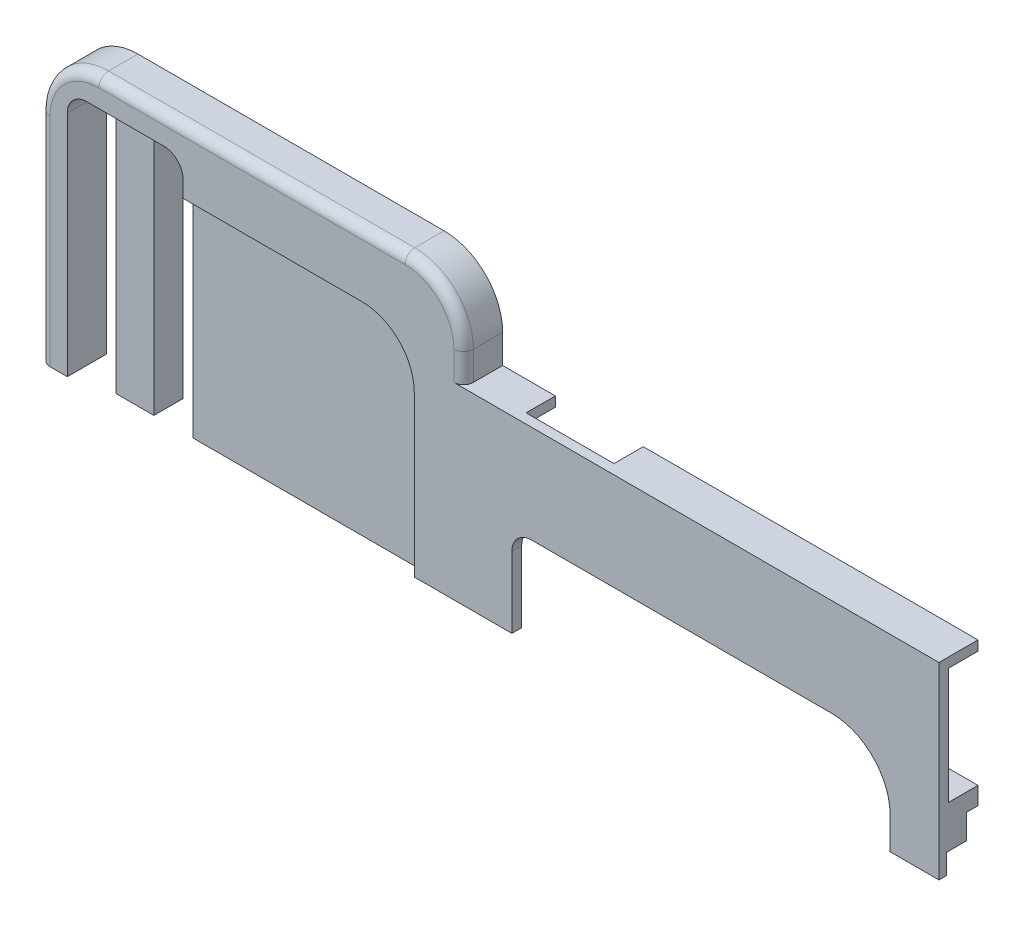
from build123d import *

# Parameters (mm, degrees)
EXTRUDE1_DEPTH           = 5.08
EXTRUDE2_DEPTH           = 1.27
EXTRUDE3_DEPTH           = 3.81
SKETCH1_5_W              = 4.91012523
SKETCH1_5_H              = 32.245498845
EXTRUDE4_DEPTH           = 3.81
FILLET2_R                = 1.27
FILLET3_R                = 1.27
SKETCH3_W                = 7.62
SKETCH3_H                = 71.709798158
CUT_EXTRUDE1_DEPTH       = 69.436
EXTRUDE_THIN4_DEPTH      = 61.816
EXTRUDE_THIN4_DEPTH_BACK = 5.08
SKETCH3_4_W              = 10.16
SKETCH3_4_H              = 48.987051728
SKETCH3_4_W_2            = 7.62
SKETCH3_4_H_2            = 46.447051728
CUT_EXTRUDE2_DEPTH       = 132.052100446
CUT_EXTRUDE2_DEPTH_BACK  = 132.052100446
SKETCH4_W                = 11.43
SKETCH4_H                = 7.62
CUT_EXTRUDE3_DEPTH       = 123.667785998
EXTRUDE7_START           = -6.35
EXTRUDE7_DEPTH           = 6.35
CUT_EXTRUDE4_DEPTH       = 6.35
CUT_EXTRUDE4_DRAFT       = -1
CUT_EXTRUDE5_DEPTH       = 123.351814538
CUT_EXTRUDE5_DEPTH_BACK  = 123.351814538


# Read off the part's stored shape, not the designer's step: Extrude7
with BuildPart() as part:
    # Sketch1 → Extrude1 (new, symmetric)
    with BuildSketch(Plane.XY):
        with BuildLine():
            Line((55.053954756, 23.223525864), (55.053954756, 28.234899079))
            ThreePointArc((55.053954756, 28.234899079), (52.822108428, 33.623052752), (47.433954756, 35.854899079))
            Line((47.433954756, 35.854899079), (7.62, 35.854899079))
            ThreePointArc((7.62, 35.854899079), (2.231846327, 33.623052752), (0, 28.234899079))
            Line((0, 28.234899079), (0, -28.234899079))
            ThreePointArc((0, -28.234899079), (2.231846327, -33.623052752), (7.62, -35.854899079))
            Line((7.62, -35.854899079), (47.433954756, -35.854899079))
            ThreePointArc((47.433954756, -35.854899079), (52.822108428, -33.623052752), (55.053954756, -28.234899079))
            Line((55.053954756, -28.234899079), (55.053954756, -23.223525864))
            Line((55.053954756, -23.223525864), (55.053954756, -19.324782682))
            Line((55.053954756, -19.324782682), (55.053954756, -16.240810389))
            Line((55.053954756, -16.240810389), (55.053954756, -5.571934871))
            Line((55.053954756, -5.571934871), (55.053954756, -2.359181621))
            Line((55.053954756, -2.359181621), (55.053954756, 2.359181621))
            Line((55.053954756, 2.359181621), (55.053954756, 5.571934871))
            Line((55.053954756, 5.571934871), (55.053954756, 16.240810389))
            Line((55.053954756, 16.240810389), (55.053954756, 19.324782682))
            Line((55.053954756, 19.324782682), (55.053954756, 23.223525864))
        make_face()
        with BuildLine():
            ThreePointArc((16.048576777, 32.245498845), (17.844628001, 31.501550069), (18.588576777, 29.705498845))
            Line((18.588576777, 29.705498845), (18.588576777, 27.618036038))
            Line((18.588576777, 27.618036038), (41.829183295, 27.618036038))
            ThreePointArc((41.829183295, 27.618036038), (46.643426698, 25.623911128), (48.637551607, 20.809667725))
            Line((48.637551607, 20.809667725), (48.637551607, -20.809667725))
            ThreePointArc((48.637551607, -20.809667725), (46.643426698, -25.623911128), (41.829183295, -27.618036038))
            Line((41.829183295, -27.618036038), (18.588576777, -27.618036038))
            Line((18.588576777, -27.618036038), (18.588576777, -29.705498845))
            ThreePointArc((18.588576777, -29.705498845), (17.844628001, -31.501550069), (16.048576777, -32.245498845))
            Line((16.048576777, -32.245498845), (13.508576777, -32.245498845))
            Line((13.508576777, -32.245498845), (8.598451547, -32.245498845))
            Line((8.598451547, -32.245498845), (6.058451547, -32.245498845))
            ThreePointArc((6.058451547, -32.245498845), (4.262400322, -31.501550069), (3.518451547, -29.705498845))
            Line((3.518451547, -29.705498845), (3.518451547, 29.705498845))
            ThreePointArc((3.518451547, 29.705498845), (4.262400322, 31.501550069), (6.058451547, 32.245498845))
            Line((6.058451547, 32.245498845), (8.598451547, 32.245498845))
            Line((8.598451547, 32.245498845), (13.508576777, 32.245498845))
            Line((13.508576777, 32.245498845), (16.048576777, 32.245498845))
        make_face(mode=Mode.SUBTRACT)
    extrude(amount=EXTRUDE1_DEPTH, both=True)

    # Sketch1<3> → Extrude2 (add, symmetric)
    with BuildSketch(Plane.XY):
        Polygon((110.911701022, 19.324782682), (55.053954756, 19.324782682), (55.053954756, 16.240810389), (107.354901489, 16.240810389), align=None)
        Polygon((114.44157437, -2.359181621), (55.053954756, -2.359181621), (55.053954756, -5.571934871), (107.985089149, -5.571934871), align=None)
        Polygon((107.985089149, 5.571934871), (55.053954756, 5.571934871), (55.053954756, 2.359181621), (114.44157437, 2.359181621), align=None)
        Polygon((107.354901489, -16.240810389), (55.053954756, -16.240810389), (55.053954756, -19.324782682), (110.911701022, -19.324782682), align=None)
    extrude(amount=EXTRUDE2_DEPTH, both=True)

    # Sketch1<4> → Extrude3 (add, symmetric)
    with BuildSketch(Plane.XY):
        with BuildLine():
            Line((99.162437765, 23.223525864), (55.053954756, 23.223525864))
            Line((55.053954756, 23.223525864), (55.053954756, 19.324782682))
            Line((55.053954756, 19.324782682), (110.911701022, 19.324782682))
            ThreePointArc((110.911701022, 19.324782682), (111.567818322, 19.699285472), (111.579007121, 20.454677463))
            Line((111.579007121, 20.454677463), (109.51169598, 24.204470623))
            ThreePointArc((109.51169598, 24.204470623), (105.172136608, 28.674517094), (99.162437765, 30.316653142))
            Line((99.162437765, 30.316653142), (99.162437765, 23.223525864))
        make_face()
        Polygon((114.44157437, 2.359181621), (55.053954756, 2.359181621), (55.053954756, -2.359181621), (114.44157437, -2.359181621), (117.074513308, -1.049028675), (117.074513308, 1.049028675), align=None)
        with BuildLine():
            Line((55.053954756, -19.324782682), (55.053954756, -23.223525864))
            Line((55.053954756, -23.223525864), (99.162437765, -23.223525864))
            Line((99.162437765, -23.223525864), (99.162437765, -30.316653142))
            ThreePointArc((99.162437765, -30.316653142), (105.172136608, -28.674517094), (109.51169598, -24.204470623))
            Line((109.51169598, -24.204470623), (111.579007121, -20.454677463))
            ThreePointArc((111.579007121, -20.454677463), (111.567818322, -19.699285472), (110.911701022, -19.324782682))
            Line((110.911701022, -19.324782682), (55.053954756, -19.324782682))
        make_face()
    extrude(amount=EXTRUDE3_DEPTH, both=True)

    # Sketch1<5> → Extrude4 (add, symmetric)
    with BuildSketch(Plane.XY):
        with BuildLine():
            Line((48.637551607, 0), (18.588576777, 0))
            Line((18.588576777, 0), (18.588576777, -27.618036038))
            Line((18.588576777, -27.618036038), (41.829183295, -27.618036038))
            ThreePointArc((41.829183295, -27.618036038), (46.643426698, -25.623911128), (48.637551607, -20.809667725))
            Line((48.637551607, -20.809667725), (48.637551607, 0))
        make_face()
        with BuildLine():
            Line((18.588576777, 27.618036038), (18.588576777, 0))
            Line((18.588576777, 0), (48.637551607, 0))
            Line((48.637551607, 0), (48.637551607, 20.809667725))
            ThreePointArc((48.637551607, 20.809667725), (46.643426698, 25.623911128), (41.829183295, 27.618036038))
            Line((41.829183295, 27.618036038), (18.588576777, 27.618036038))
        make_face()
        with Locations((11.053514162, -16.122749423)):
            Rectangle(SKETCH1_5_W, SKETCH1_5_H)
        with Locations((11.053514162, 16.122749423)):
            Rectangle(SKETCH1_5_W, SKETCH1_5_H)
    extrude(amount=EXTRUDE4_DEPTH, both=True)

    # Fillet2
    fillet2_edges = [part.edges().sort_by_distance(p)[0] for p in [
        (30.208880036, -27.618036038, -3.81),
        (30.208880036, -27.618036038, 3.81),
        (46.643426698, -25.623911128, -3.81),
        (46.643426698, -25.623911128, 3.81),
        (48.637551607, 0, -3.81),
        (48.637551607, 0, 3.81),
        (46.643426698, 25.623911128, -3.81),
        (46.643426698, 25.623911128, 3.81),
        (30.208880036, 27.618036038, -3.81),
        (30.208880036, 27.618036038, 3.81),
    ]]
    fillet(fillet2_edges, radius=FILLET2_R - 0.0001)  # a hair under: the kernel refuses the full size

    # Fillet3
    fillet3_edges = [part.edges().sort_by_distance(p)[0] for p in [
        (2.231846327, 33.623052752, -5.08),
        (27.526977378, 35.854899079, -5.08),
        (52.822108428, 33.623052752, -5.08),
        (55.053954756, 0, -5.08),
        (52.822108428, -33.623052752, -5.08),
        (27.526977378, -35.854899079, -5.08),
        (2.231846327, -33.623052752, -5.08),
        (0, 0, -5.08),
        (0, 0, 5.08),
        (2.231846327, -33.623052752, 5.08),
        (27.526977378, -35.854899079, 5.08),
        (52.822108428, -33.623052752, 5.08),
        (55.053954756, 0, 5.08),
        (52.822108428, 33.623052752, 5.08),
        (27.526977378, 35.854899079, 5.08),
        (2.231846327, 33.623052752, 5.08),
    ]]
    fillet(fillet3_edges, radius=FILLET3_R - 0.0001)  # a hair under: the kernel refuses the full size

    # Sketch3 → Cut-Extrude1 (cut)
    with BuildSketch(Plane(origin=(55.053954756, 0, 0), x_dir=(0, 0, -1), z_dir=(1, 0, 0))):
        Rectangle(SKETCH3_W, SKETCH3_H)
    extrude(amount=CUT_EXTRUDE1_DEPTH, mode=Mode.SUBTRACT)

    # Sketch3<4> → Extrude-Thin4 (add, two sides: drawn at the far end of the back side and taken through both)
    with BuildSketch(Plane(origin=(55.053954756, 0, 0), x_dir=(0, 0, -1), z_dir=(1, 0, 0)).offset(-EXTRUDE_THIN4_DEPTH_BACK)):
        Rectangle(SKETCH3_4_W, SKETCH3_4_H)
        Rectangle(SKETCH3_4_W_2, SKETCH3_4_H_2, mode=Mode.SUBTRACT)
    extrude(amount=EXTRUDE_THIN4_DEPTH + EXTRUDE_THIN4_DEPTH_BACK)

    # Sketch4 → Cut-Extrude2 (cut, two sides: drawn at the far end of the back side and taken through both)
    with BuildSketch(Plane.XZ.offset(-23.223525864).offset(-CUT_EXTRUDE2_DEPTH_BACK)):
        with Locations((67.626954756, 0)):
            Rectangle(SKETCH4_W, SKETCH4_H)
    extrude(amount=CUT_EXTRUDE2_DEPTH + CUT_EXTRUDE2_DEPTH_BACK, mode=Mode.SUBTRACT)

    # Sketch5 → Cut-Extrude3 (cut, through all)
    with BuildSketch(Plane(origin=(0, 0, -5.08), x_dir=(-1, 0, 0), z_dir=(0, 0, -1))):
        with BuildLine():
            Line((-102.899954756, 11.793525864), (-63.877551607, 11.793525864))
            ThreePointArc((-63.877551607, 11.793525864), (-62.081500383, 11.049577089), (-61.337551607, 9.253525864))
            Line((-61.337551607, 9.253525864), (-61.337551607, -4.173525864))
            ThreePointArc((-61.337551607, -4.173525864), (-63.569397935, -9.561679537), (-68.957551607, -11.793525864))
            Line((-68.957551607, -11.793525864), (-107.979954756, -11.793525864))
            ThreePointArc((-107.979954756, -11.793525864), (-109.77600598, -11.049577089), (-110.519954756, -9.253525864))
            Line((-110.519954756, -9.253525864), (-110.519954756, 4.173525864))
            ThreePointArc((-110.519954756, 4.173525864), (-108.288108428, 9.561679537), (-102.899954756, 11.793525864))
        make_face()
    extrude(amount=-CUT_EXTRUDE3_DEPTH, mode=Mode.SUBTRACT)

    # Extrude7 outline → Extrude7 (add)
    with BuildSketch(Plane(origin=(116.869954756, 0, 0), x_dir=(0, 0, -1), z_dir=(1, 0, 0)).offset(EXTRUDE7_START)):
        Polygon((-1.27, 5.571934871), (1.27, 5.571934871), (1.27, 2.359181621), (3.81, 2.359181621), (3.81, 8.111934871), (-3.81, 8.111934871), (-3.81, 2.359181621), (-1.27, 2.359181621), align=None)
        Polygon((3.81, -8.111934871), (3.81, -2.359181621), (1.27, -2.359181621), (1.27, -5.571934871), (-1.27, -5.571934871), (-1.27, -2.359181621), (-3.81, -2.359181621), (-3.81, -8.111934871), align=None)
    extrude(amount=EXTRUDE7_DEPTH)


with BuildPart() as cut_extrude4_tool:
    # Sketch7 → Cut-Extrude4 (with draft: the straight prism first)
    with BuildSketch(Plane(origin=(116.869954756, 0, 0), x_dir=(0, 0, -1), z_dir=(1, 0, 0))):
        Polygon((-1.524, 2.613181621), (-4.064, 2.613181621), (-4.064, -2.613181621), (-1.524, -2.613181621), (-1.524, -5.825934871), (1.524, -5.825934871), (1.524, -2.613181621), (4.064, -2.613181621), (4.064, 2.613181621), (1.524, 2.613181621), (1.524, 5.825934871), (-1.524, 5.825934871), align=None)
    extrude(amount=-CUT_EXTRUDE4_DEPTH)
    # Cut-Extrude4: the draft: its side faces are tilted about the plane it starts from
    cut_extrude4_sides = [cut_extrude4_tool.faces().sort_by_distance(p)[0] for p in [
        (113.694954756, 2.613181621, 2.794),
        (113.694954756, 0, 4.064),
        (113.694954756, -2.613181621, 2.794),
        (113.694954756, -4.219558246, 1.524),
        (113.694954756, -5.825934871, 0),
        (113.694954756, -4.219558246, -1.524),
        (113.694954756, -2.613181621, -2.794),
        (113.694954756, 0, -4.064),
        (113.694954756, 2.613181621, -2.794),
        (113.694954756, 4.219558246, -1.524),
        (113.694954756, 5.825934871, 0),
        (113.694954756, 4.219558246, 1.524),
    ]]
    draft(cut_extrude4_sides, Plane(origin=(116.869954756, 0, 0), x_dir=(0, 0, -1), z_dir=(1, 0, 0)), CUT_EXTRUDE4_DRAFT)


with BuildPart() as part_1:
    add(part.part)

    # Cut-Extrude4: cut by cut_extrude4_tool
    add(cut_extrude4_tool.part, mode=Mode.SUBTRACT)

    # Sketch8 → Cut-Extrude5 (cut, two sides: drawn at the far end of the back side and taken through both)
    with BuildSketch(Plane(origin=(116.869954756, 0, 0), x_dir=(0, 0, -1), z_dir=(1, 0, 0)).offset(-CUT_EXTRUDE5_DEPTH_BACK)):
        Polygon((-158.859018875, 0), (-5.08, 0), (0, 0), (0, 35.854899079), (0, 189.633917954), (235.763888228, -7.868830363), (76.904869352, -197.502748317), align=None)
    extrude(amount=CUT_EXTRUDE5_DEPTH + CUT_EXTRUDE5_DEPTH_BACK, mode=Mode.SUBTRACT)


solid = part_1.part
